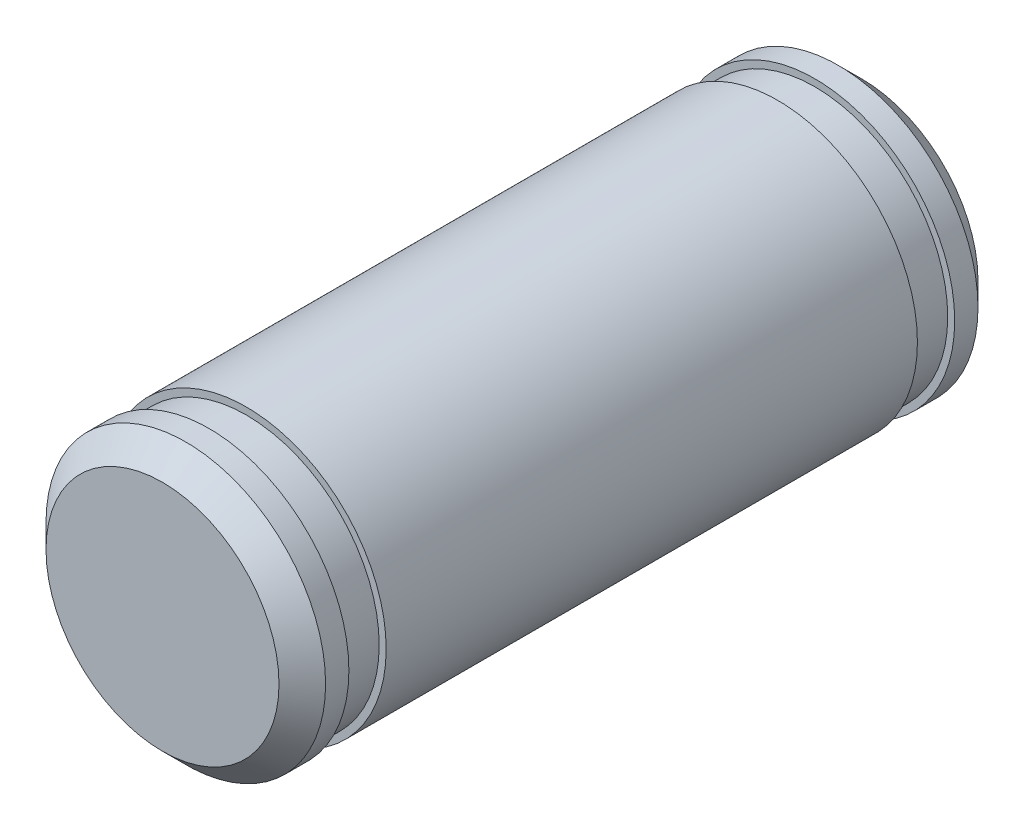
from build123d import *

# Parameters (mm, degrees)
SZKIC1_R                    = 3
DODANIE_WYCI_GNI_CIE1_DEPTH = 15
SFAZOWANIE1_SIZE            = 0.5
WYTNIJ_WYCI_GNI_CIE1_START  = -1.8
SZKIC2_R                    = 3
SZKIC2_R_2                  = 2.85
WYTNIJ_WYCI_GNI_CIE1_DEPTH  = 0.8
WYTNIJ_WYCI_GNI_CIE2_START  = -1
SZKIC3_R                    = 3
SZKIC3_R_2                  = 2.85
WYTNIJ_WYCI_GNI_CIE2_DEPTH  = 0.8


with BuildPart() as part:
    # Szkic1 → Dodanie-wyciągnięcie1 (new body)
    with BuildSketch(Plane.XY):
        Circle(SZKIC1_R)
    extrude(amount=DODANIE_WYCI_GNI_CIE1_DEPTH)

    # Sfazowanie1
    sfazowanie1_edges = [part.edges().sort_by_distance(p)[0] for p in [
        (-3, 0, 0),
        (-3, 0, 15),
    ]]
    chamfer(sfazowanie1_edges, length=SFAZOWANIE1_SIZE)

    # Szkic2 → Wytnij-wyciągnięcie1 (cut)
    with BuildSketch(Plane.XY.offset(15).offset(WYTNIJ_WYCI_GNI_CIE1_START)):
        Circle(SZKIC2_R)
        Circle(SZKIC2_R_2, mode=Mode.SUBTRACT)
    extrude(amount=WYTNIJ_WYCI_GNI_CIE1_DEPTH, mode=Mode.SUBTRACT)

    # Szkic3 → Wytnij-wyciągnięcie2 (cut)
    with BuildSketch(Plane(origin=(0, 0, 0), x_dir=(-1, 0, 0), z_dir=(0, 0, -1)).offset(WYTNIJ_WYCI_GNI_CIE2_START)):
        Circle(SZKIC3_R)
        Circle(SZKIC3_R_2, mode=Mode.SUBTRACT)
    extrude(amount=-WYTNIJ_WYCI_GNI_CIE2_DEPTH, mode=Mode.SUBTRACT)


solid = part.part
